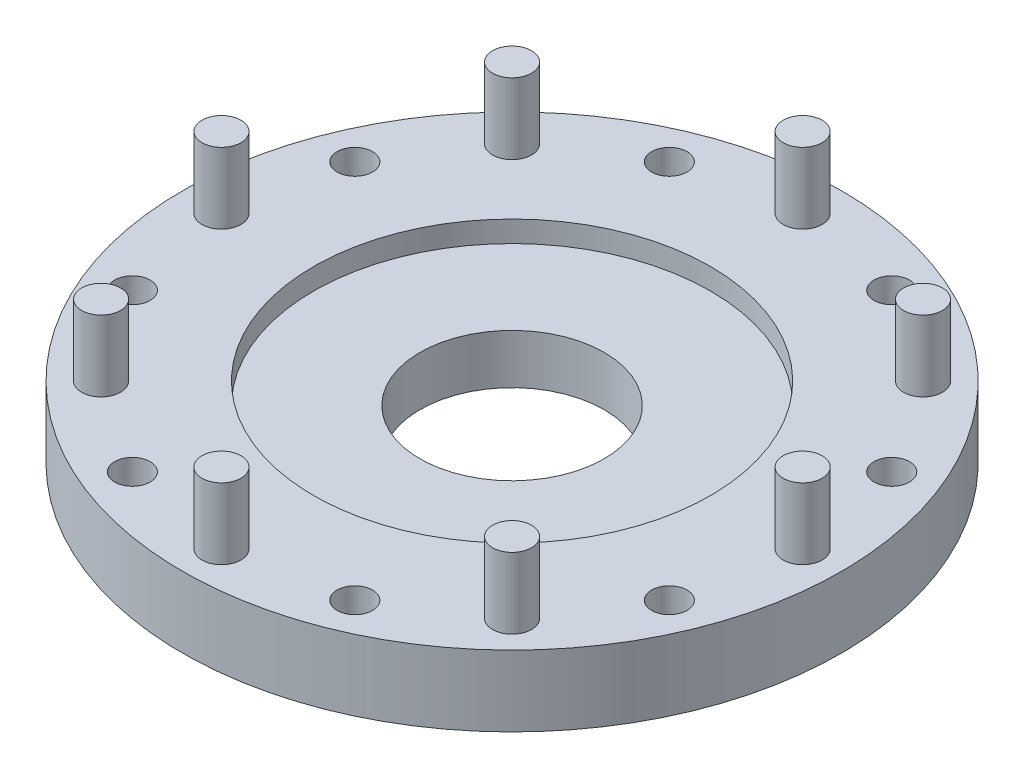
from build123d import *

# Parameters (mm, degrees)
CUT_EXTRUDE1_DEPTH      = 67.516915142
CUT_EXTRUDE1_DEPTH_BACK = 67.516915142
SKETCH2_R               = 2.75
SKETCH2_R_2             = 2.5
SKETCH3_W               = 5
SKETCH3_H               = 4
CUT_EXTRUDE2_DEPTH      = 5
BOSS_EXTRUDE1_START     = -20
SKETCH5_R               = 2.75
BOSS_EXTRUDE1_DEPTH     = 20


with BuildPart() as part:
    # Sketch1 → Revolve1 (revolve)
    with BuildSketch(Plane.XY):
        Polygon((-28, 10), (-46.5, 10), (-46.5, 0), (-13, 0), (-13, 7), (-28, 7), align=None)
    revolve(axis=Axis((0, -1.751877994, 0), (0, 1, 0)))

    # Sketch2 → Cut-Extrude1 (cut, two sides: drawn at the far end of the back side and taken through both)
    with BuildSketch(Plane(origin=(0, 10, 0), x_dir=(1, 0, 0), z_dir=(0, 1, 0)).offset(-CUT_EXTRUDE1_DEPTH_BACK)):
        with Locations((0, 41)):
            Circle(SKETCH2_R)
        with Locations((15.690020727, 37.879060833)):
            Circle(SKETCH2_R_2)
        with Locations((28.991378029, 28.991378029)):
            Circle(SKETCH2_R)
        with Locations((37.879060833, 15.690020727)):
            Circle(SKETCH2_R_2)
        with Locations((41, 0)):
            Circle(SKETCH2_R)
        with Locations((37.879060833, -15.690020727)):
            Circle(SKETCH2_R_2)
        with Locations((28.991378029, -28.991378029)):
            Circle(SKETCH2_R)
        with Locations((15.690020727, -37.879060833)):
            Circle(SKETCH2_R_2)
        with Locations((0, -41)):
            Circle(SKETCH2_R)
        with Locations((-15.690020727, -37.879060833)):
            Circle(SKETCH2_R_2)
        with Locations((-28.991378029, -28.991378029)):
            Circle(SKETCH2_R)
        with Locations((-37.879060833, -15.690020727)):
            Circle(SKETCH2_R_2)
        with Locations((-41, 0)):
            Circle(SKETCH2_R)
        with Locations((-37.879060833, 15.690020727)):
            Circle(SKETCH2_R_2)
        with Locations((-28.991378029, 28.991378029)):
            Circle(SKETCH2_R)
        with Locations((-15.690020727, 37.879060833)):
            Circle(SKETCH2_R_2)
    extrude(amount=CUT_EXTRUDE1_DEPTH + CUT_EXTRUDE1_DEPTH_BACK, mode=Mode.SUBTRACT)

    # Sketch3 → Cut-Revolve1 (revolve, cut)
    with BuildSketch(Plane.XY):
        with Locations((25, 2)):
            Rectangle(SKETCH3_W, SKETCH3_H)
    revolve(axis=Axis((0, -19.065406541, 0), (0, 1, 0)), mode=Mode.SUBTRACT)

    # Sketch4 → Cut-Extrude2 (cut)
    with BuildSketch(Plane.XZ):
        Polygon((-19.154122342, 39.879060833), (-19.154122342, 35.879060833), (-15.690020727, 33.879060833), (-12.225919112, 35.879060833), (-12.225919112, 39.879060833), (-15.690020727, 41.879060833), align=None)
        Polygon((18.518447852, 40.707487958), (14.654744547, 41.742764138), (11.826317422, 38.914337013), (12.861593602, 35.050633708), (16.725296907, 34.015357528), (19.553724032, 36.843784653), align=None)
        Polygon((41.879060833, 15.690020727), (39.879060833, 19.154122342), (35.879060833, 19.154122342), (33.879060833, 15.690020727), (35.879060833, 12.225919112), (39.879060833, 12.225919112), align=None)
        Polygon((40.707487958, -18.518447852), (41.742764138, -14.654744547), (38.914337013, -11.826317422), (35.050633708, -12.861593602), (34.015357528, -16.725296907), (36.843784653, -19.553724032), align=None)
        Polygon((15.690020727, -41.879060833), (19.154122342, -39.879060833), (19.154122342, -35.879060833), (15.690020727, -33.879060833), (12.225919112, -35.879060833), (12.225919112, -39.879060833), align=None)
        Polygon((-18.518447852, -40.707487958), (-14.654744547, -41.742764138), (-11.826317422, -38.914337013), (-12.861593602, -35.050633708), (-16.725296907, -34.015357528), (-19.553724032, -36.843784653), align=None)
        Polygon((-41.879060833, -15.690020727), (-39.879060833, -19.154122342), (-35.879060833, -19.154122342), (-33.879060833, -15.690020727), (-35.879060833, -12.225919112), (-39.879060833, -12.225919112), align=None)
        Polygon((-40.707487958, 18.518447852), (-41.742764138, 14.654744547), (-38.914337013, 11.826317422), (-35.050633708, 12.861593602), (-34.015357528, 16.725296907), (-36.843784653, 19.553724032), align=None)
    extrude(amount=-CUT_EXTRUDE2_DEPTH, mode=Mode.SUBTRACT)

    # Sketch5 → Boss-Extrude1 (add)
    with BuildSketch(Plane.XZ.offset(BOSS_EXTRUDE1_START)):
        with Locations((0, 41)):
            Circle(SKETCH5_R)
        with Locations((28.991378029, 28.991378029)):
            Circle(SKETCH5_R)
        with Locations((41, 0)):
            Circle(SKETCH5_R)
        with Locations((28.991378029, -28.991378029)):
            Circle(SKETCH5_R)
        with Locations((0, -41)):
            Circle(SKETCH5_R)
        with Locations((-28.991378029, -28.991378029)):
            Circle(SKETCH5_R)
        with Locations((-41, 0)):
            Circle(SKETCH5_R)
        with Locations((-28.991378029, 28.991378029)):
            Circle(SKETCH5_R)
    extrude(amount=BOSS_EXTRUDE1_DEPTH)


solid = part.part
